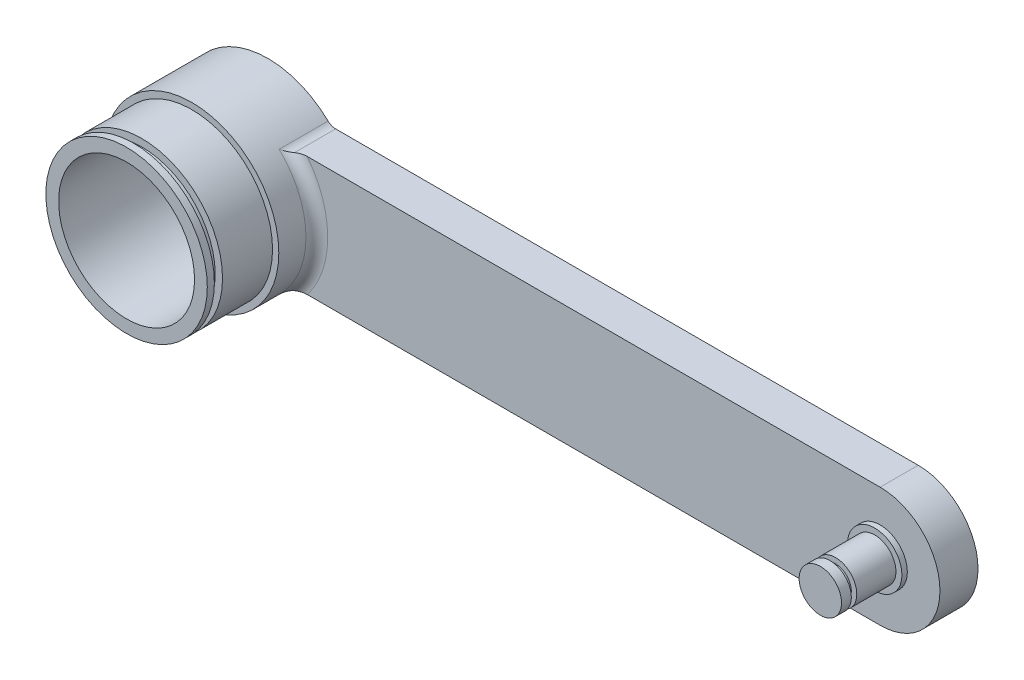
from build123d import *

# Parameters (mm, degrees)
EXTRUDE_1_DEPTH     = 7
SKETCH_2_R          = 6.7
CUT_EXTRUDE_1_DEPTH = 7
SKETCH_3_R          = 12.5
SKETCH_3_R_2        = 6.7
CUT_EXTRUDE_2_DEPTH = 5
SKETCH_4_R          = 16
SKETCH_4_R_2        = 12.5
EXTRUDE_2_DEPTH     = 7
SKETCH_5_R          = 14.850000000000001
SKETCH_5_R_2        = 12.5
EXTRUDE_3_DEPTH     = 12
SKETCH_6_R          = 5.000000000000004
EXTRUDE_4_DEPTH     = 1
SKETCH_7_R          = 3.899999999999998
EXTRUDE_5_DEPTH     = 10
FILLET_1_R          = 2
SKETCH_8_R          = 1.4999999999999998
SKETCH_8_R_2        = 1.5000000000000002
SKETCH_8_R_3        = 1.4999999999999991
CUT_EXTRUDE_3_DEPTH = 10
SKETCH_9_R          = 14.850000000000001
SKETCH_9_R_2        = 13.5
CUT_EXTRUDE_4_DEPTH = 1.5
SKETCH_10_R         = 3.899999999999998
SKETCH_10_R_2       = 2.9
CUT_EXTRUDE_5_DEPTH = 1


with BuildPart() as part:
    # 草图1 → 凸台-拉伸1 (new body)
    with BuildSketch(Plane.XY):
        with BuildLine():
            Line((119.60958057927934, 11), (11.61895003862225, 11))
            ThreePointArc((11.61895003862225, 11), (-16, 1.96e-15), (11.61895003862225, -11))
            Line((11.61895003862225, -11), (119.60958057927934, -11))
            ThreePointArc((119.60958057927934, -11), (130.60958057927934, 0), (119.60958057927934, 11))
        make_face()
    extrude(amount=EXTRUDE_1_DEPTH)

    # 草图2 → 切除-拉伸1 (cut)
    with BuildSketch(Plane.XY.offset(7)):
        Circle(SKETCH_2_R)
    extrude(amount=-CUT_EXTRUDE_1_DEPTH, mode=Mode.SUBTRACT)

    # 草图3 → 切除-拉伸2 (cut)
    with BuildSketch(Plane.XY.offset(7)):
        Circle(SKETCH_3_R)
        Circle(SKETCH_3_R_2, mode=Mode.SUBTRACT)
    extrude(amount=-CUT_EXTRUDE_2_DEPTH, mode=Mode.SUBTRACT)

    # 草图4 → 凸台-拉伸2 (add)
    with BuildSketch(Plane.XY.offset(7)):
        Circle(SKETCH_4_R)
        Circle(SKETCH_4_R_2, mode=Mode.SUBTRACT)
    extrude(amount=EXTRUDE_2_DEPTH)

    # 草图5 → 凸台-拉伸3 (add)
    with BuildSketch(Plane.XY.offset(14)):
        Circle(SKETCH_5_R)
        Circle(SKETCH_5_R_2, mode=Mode.SUBTRACT)
    extrude(amount=EXTRUDE_3_DEPTH)

    # 草图6 → 凸台-拉伸4 (add)
    with BuildSketch(Plane.XY.offset(7)):
        with Locations((119.60958057927934, 0)):
            Circle(SKETCH_6_R)
    extrude(amount=EXTRUDE_4_DEPTH)

    # 草图7 → 凸台-拉伸5 (add)
    with BuildSketch(Plane.XY.offset(8)):
        with Locations((119.60958057927934, 0)):
            Circle(SKETCH_7_R)
    extrude(amount=EXTRUDE_5_DEPTH)

    # 圆角1
    fillet_1_edges = [part.edges().sort_by_distance(p)[0] for p in [
        (11.618950038622248, -11.000000000000002, 3.5),
        (11.61895003862225, 11, 3.5),
        (14.864440800412844, 5.920168890413684, 7),
    ]]
    fillet(fillet_1_edges, radius=FILLET_1_R)

    # 草图8 → 切除-拉伸3 (cut)
    with BuildSketch(Plane(origin=(0, 0, 0), x_dir=(-1, 0, 0), z_dir=(0, 0, -1))):
        with Locations((0, -9.5)):
            Circle(SKETCH_8_R)
        with Locations((-8.227241335952145, 4.75000000000004)):
            Circle(SKETCH_8_R_2)
        with Locations((8.22724133595221, 4.749999999999924)):
            Circle(SKETCH_8_R_3)
    extrude(amount=-CUT_EXTRUDE_3_DEPTH, mode=Mode.SUBTRACT)

    # 草图9 → 切除-拉伸4 (cut)
    with BuildSketch(Plane.XY.offset(23.200000000000003)):
        Circle(SKETCH_9_R)
        Circle(SKETCH_9_R_2, mode=Mode.SUBTRACT)
    extrude(amount=CUT_EXTRUDE_4_DEPTH, mode=Mode.SUBTRACT)

    # 草图10 → 切除-拉伸5 (cut)
    with BuildSketch(Plane.XY.offset(15.200000000000001)):
        with Locations((119.60958057927934, 0)):
            Circle(SKETCH_10_R)
        with Locations((119.60958057927934, 0)):
            Circle(SKETCH_10_R_2, mode=Mode.SUBTRACT)
    extrude(amount=CUT_EXTRUDE_5_DEPTH, mode=Mode.SUBTRACT)


solid = part.part
